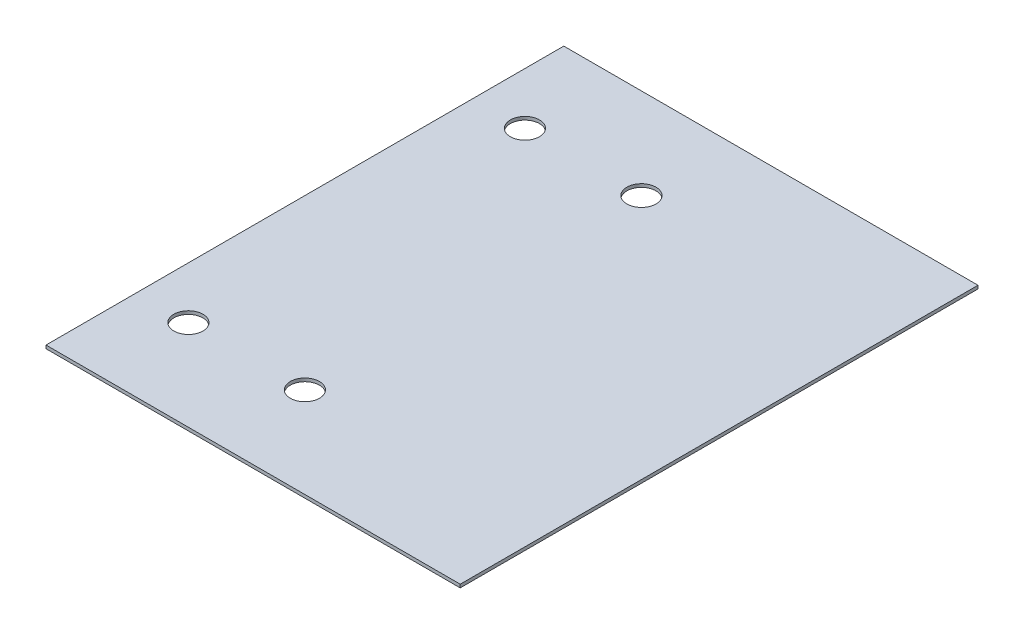
from build123d import *

# Parameters (mm, degrees)
SKETCH1_W           = 406.4
SKETCH1_H           = 508
BOSS_EXTRUDE1_DEPTH = 3.175
SKETCH2_R           = 14.2875
CUT_EXTRUDE1_DEPTH  = 3.175


with BuildPart() as part:
    # Sketch1 → Boss-Extrude1 (new body)
    with BuildSketch(Plane(origin=(0, 0, 0), x_dir=(1, 0, 0), z_dir=(0, 1, 0))):
        with Locations((203.2, 254)):
            Rectangle(SKETCH1_W, SKETCH1_H)
    extrude(amount=BOSS_EXTRUDE1_DEPTH)

    # Sketch2 → Cut-Extrude1 (cut)
    with BuildSketch(Plane(origin=(0, 3.175, 0), x_dir=(1, 0, 0), z_dir=(0, 1, 0))):
        with Locations((50.8, 419.1)):
            Circle(SKETCH2_R)
        with Locations((165.1, 419.1)):
            Circle(SKETCH2_R)
        with Locations((50.8, 88.9)):
            Circle(SKETCH2_R)
        with Locations((165.1, 88.9)):
            Circle(SKETCH2_R)
    extrude(amount=-CUT_EXTRUDE1_DEPTH, mode=Mode.SUBTRACT)


solid = part.part
